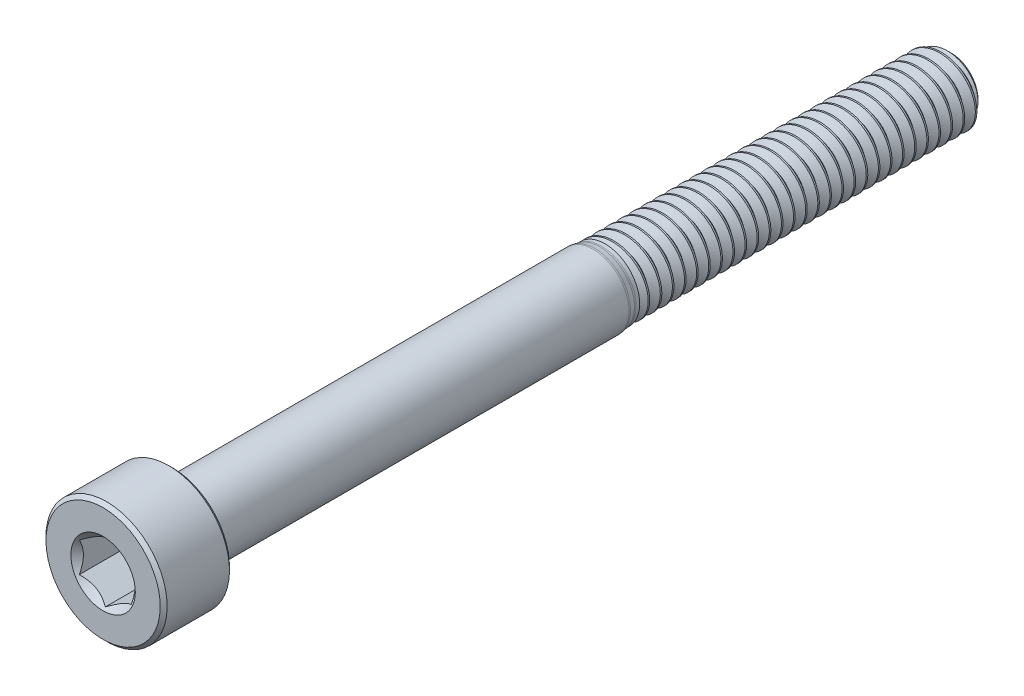
from build123d import *

# Parameters (mm, degrees)
CUT_EXTRUDE1_DEPTH     = 3
SPLIT1_SURFACE_1_BACK  = 50.99
SPLIT1_SURFACE_1_DEPTH = 101.98
SPLIT1_SURFACE_2_BACK  = 50.99
SPLIT1_SURFACE_2_DEPTH = 101.98
CUT_SWEEP1_PITCH       = 0.7
CUT_SWEEP1_TO          = 20


with BuildPart() as part:
    # Sketch2 → Revolve1 (revolve)
    with BuildSketch(Plane(origin=(0, 0, 0), x_dir=(0, 0, -1), z_dir=(1, 0, 0))):
        with BuildLine():
            Line((-24.5, 0), (-24.5, 3.3))
            Line((-24.5, 3.3), (-24.3, 3.5))
            Line((-24.3, 3.5), (-20.7, 3.5))
            Line((-20.7, 3.5), (-20.5, 3.3))
            Line((-20.5, 3.3), (-20.5, 2.275777223))
            ThreePointArc((-20.5, 2.275777223), (-20.441421356, 2.134355867), (-20.3, 2.075777223))
            Line((-20.3, 2.075777223), (3.807296473, 2.075777223))
            ThreePointArc((3.807296473, 2.075777223), (3.856305044, 2.073369586), (3.904841634, 2.066169863))
            Line((3.904841634, 2.066169863), (4.189200541, 2.00960736))
            ThreePointArc((4.189200541, 2.00960736), (4.237737132, 2.002407637), (4.286745702, 2))
            Line((4.286745702, 2), (24.045336663, 2))
            Line((24.045336663, 2), (24.5, 1.545336663))
            Line((24.5, 1.545336663), (24.5, 0))
            Line((24.5, 0), (-24.5, 0))
        make_face()
    revolve(axis=Axis((0, 0, -24.5), (0, 0, 1)))

    # Sketch3 → Cut-Extrude1 (cut)
    with BuildSketch(Plane.XY.offset(24.5)):
        Polygon((1.5, -0.866025404), (1.5, 0.866025404), (0, 1.732050808), (-1.5, 0.866025404), (-1.5, -0.866025404), (0, -1.732050808), align=None)
    extrude(amount=-CUT_EXTRUDE1_DEPTH, mode=Mode.SUBTRACT)

    # Cut-Extrude2 cone 1 section (through the dimple's axis) → Cut-Extrude2 (revolve, cut)
    with BuildSketch(Plane(origin=(0, 0, 24.5), x_dir=(0, -1, 0), z_dir=(1, 0, 0))):
        Polygon((0, 0), (1.861954618, 0), (0, 1.861954618), align=None)
    revolve(axis=Axis((0, 0, 24.5), (0, 0, -1)), mode=Mode.SUBTRACT)


with BuildPart() as body_2:
    # Split1: the piece behind the surface
    add(part.part)
    # Split1 surface: a surface, the sketch's curves swept straight by 101.98 mm
    with BuildLine(Plane(origin=(0, 0, 0), x_dir=(0, 0, -1), z_dir=(1, 0, 0)).offset(-SPLIT1_SURFACE_1_BACK), mode=Mode.PRIVATE) as split1_surface_1_path:
        Line((4.5, -2), (4.5, 2))
    split1_surface_1 = Shell.extrude(split1_surface_1_path.wire(), (1 * SPLIT1_SURFACE_1_DEPTH, 0 * SPLIT1_SURFACE_1_DEPTH, 0 * SPLIT1_SURFACE_1_DEPTH))
    split(bisect_by=split1_surface_1, keep=Keep.BOTTOM)

    # Cut-Sweep1: arcs per turn and ends read off the stored shape
    # Cut-Sweep1: the profile of Sketch7 screwed along a right-hand helix through 29.571429 turns, 6 arcs to a turn; built about Z, then put on its axis
    cut_sweep1_z = Axis((0, 0, 0), (0, 0, 1))
    cut_sweep1_corners = [(2.037888611, 0, 0.021875), (2.037888611, 0, -0.634375), (1.545336663, 0, -0.35), (1.545336663, 0, -0.2625)]
    with BuildLine(mode=Mode.PRIVATE) as cut_sweep1_profile:
        Line(cut_sweep1_corners[0], cut_sweep1_corners[1])
        Line(cut_sweep1_corners[1], cut_sweep1_corners[2])
        Line(cut_sweep1_corners[2], cut_sweep1_corners[3])
        Line(cut_sweep1_corners[3], cut_sweep1_corners[0])
    cut_sweep1_cap = Face(cut_sweep1_profile.wire())
    cut_sweep1_turn_angles = [0, 30, 60, 90, 120, 150, 180, 210, 240, 270, 300, 330, 360]
    cut_sweep1_turn_weights = [1, 0.8660254037844387, 1, 0.8660254037844387, 1, 0.8660254037844387, 1, 0.8660254037844387, 1, 0.8660254037844387, 1, 0.8660254037844387, 1]
    cut_sweep1_turn_rails = [Edge.make_bspline([Vector(p[0], p[1], 0).rotate(cut_sweep1_z, cut_sweep1_turn_angles[k]) / cut_sweep1_turn_weights[k] + Vector(0, 0, p[2] + CUT_SWEEP1_PITCH * cut_sweep1_turn_angles[k] / 360) for k in range(13)], [0, 0, 0, 1, 1, 2, 2, 3, 3, 4, 4, 5, 5, 6, 6, 6], 2, cut_sweep1_turn_weights) for p in cut_sweep1_corners]
    cut_sweep1_turn_sides = [Face.make_surface_from_curves(cut_sweep1_turn_rails[p[0]], cut_sweep1_turn_rails[p[1]]) for p in [(0, 1), (1, 2), (2, 3), (3, 0)]]
    cut_sweep1_last_angles = [10440, 10470, 10500, 10530, 10560, 10590, 10620, 10632.857142857, 10645.714285714]
    cut_sweep1_last_weights = [1, 0.8660254037844387, 1, 0.8660254037844387, 1, 0.8660254037844387, 1, 0.9749279121817342, 1]
    cut_sweep1_last_rails = [Edge.make_bspline([Vector(p[0], p[1], 0).rotate(cut_sweep1_z, cut_sweep1_last_angles[k]) / cut_sweep1_last_weights[k] + Vector(0, 0, p[2] + CUT_SWEEP1_PITCH * cut_sweep1_last_angles[k] / 360) for k in range(9)], [0, 0, 0, 1, 1, 2, 2, 3, 3, 4, 4, 4], 2, cut_sweep1_last_weights) for p in cut_sweep1_corners]
    cut_sweep1_last_sides = [Face.make_surface_from_curves(cut_sweep1_last_rails[p[0]], cut_sweep1_last_rails[p[1]]) for p in [(0, 1), (1, 2), (2, 3), (3, 0)]]
    cut_sweep1 = Plane(origin=(0, 0, -24.5), x_dir=(0, 1, 0), z_dir=(0, 0, 1)) * split(Solid(Shell([*[p.moved(Location((0, 0, CUT_SWEEP1_PITCH * i))) for i in range(29) for p in cut_sweep1_turn_sides], *cut_sweep1_last_sides, cut_sweep1_cap, cut_sweep1_cap.rotate(cut_sweep1_z, 10645.714285714).moved(Location((0, 0, CUT_SWEEP1_PITCH * 10645.714285714 / 360)))])), bisect_by=Plane.XY.offset(CUT_SWEEP1_TO), keep=Keep.BOTTOM, mode=Mode.PRIVATE)
    add(cut_sweep1, mode=Mode.SUBTRACT)


with BuildPart() as part_1:
    add(part.part)

    # Split1: split by a surface, the side it looks to stays
    # Split1 surface: a surface, the sketch's curves swept straight by 101.98 mm
    with BuildLine(Plane(origin=(0, 0, 0), x_dir=(0, 0, -1), z_dir=(1, 0, 0)).offset(-SPLIT1_SURFACE_2_BACK), mode=Mode.PRIVATE) as split1_surface_2_path:
        Line((4.5, -2), (4.5, 2))
    split1_surface_2 = Shell.extrude(split1_surface_2_path.wire(), (1 * SPLIT1_SURFACE_2_DEPTH, 0 * SPLIT1_SURFACE_2_DEPTH, 0 * SPLIT1_SURFACE_2_DEPTH))
    split(bisect_by=split1_surface_2, keep=Keep.TOP)

    add(body_2.part)  # Revolve2 merges body 2
    # Sketch8 → Revolve2 (revolve)
    with BuildSketch(Plane(origin=(0, 0, 0), x_dir=(0, 0, -1), z_dir=(1, 0, 0))):
        Polygon((-20.5, 0), (-20.5, 2), (4.5, 2), (5.654700538, 0), align=None)
    revolve(axis=Axis((0, 0, -5.654700538), (0, 0, 1)))


solid = part_1.part
